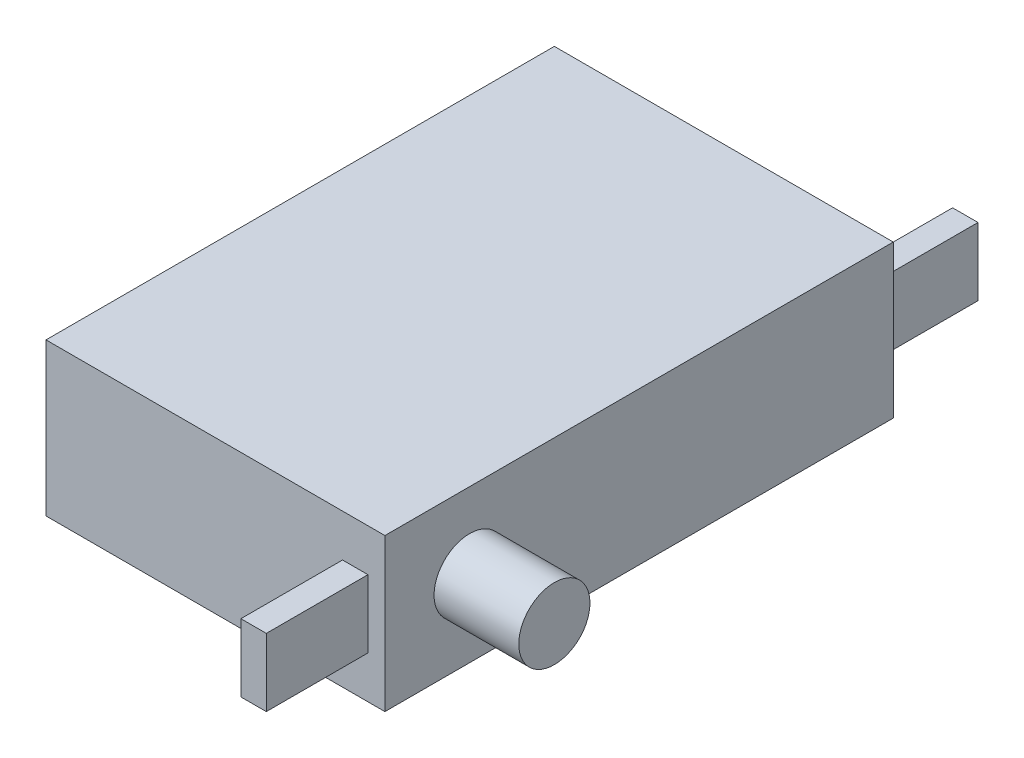
from build123d import *

# Parameters (mm, degrees)
SKETCH1_W           = 20
SKETCH1_H           = 30
BOSS_EXTRUDE1_DEPTH = 4.5
SKETCH2_R           = 2.1
BOSS_EXTRUDE2_DEPTH = 5
SKETCH3_W           = 1.5
SKETCH3_H           = 4
BOSS_EXTRUDE3_DEPTH = 6
SKETCH4_W           = 1.5
SKETCH4_H           = 4
BOSS_EXTRUDE4_DEPTH = 6


with BuildPart() as part:
    # Sketch1 → Boss-Extrude1 (new, symmetric)
    with BuildSketch(Plane(origin=(0, 0, 0), x_dir=(1, 0, 0), z_dir=(0, 1, 0))):
        with Locations((10, 15)):
            Rectangle(SKETCH1_W, SKETCH1_H)
    extrude(amount=BOSS_EXTRUDE1_DEPTH, both=True)

    # Sketch2 → Boss-Extrude2 (add)
    with BuildSketch(Plane(origin=(20, 0, 0), x_dir=(0, 0, -1), z_dir=(1, 0, 0))):
        with Locations((5, 0)):
            Circle(SKETCH2_R)
    extrude(amount=BOSS_EXTRUDE2_DEPTH)

    # Sketch3 → Boss-Extrude3 (add)
    with BuildSketch(Plane.XY):
        with Locations((18.25, 0)):
            Rectangle(SKETCH3_W, SKETCH3_H)
    extrude(amount=BOSS_EXTRUDE3_DEPTH)

    # Sketch4 → Boss-Extrude4 (add)
    with BuildSketch(Plane(origin=(0, 0, -30), x_dir=(-1, 0, 0), z_dir=(0, 0, -1))):
        with Locations((-18.25, 0)):
            Rectangle(SKETCH4_W, SKETCH4_H)
    extrude(amount=BOSS_EXTRUDE4_DEPTH)


solid = part.part
